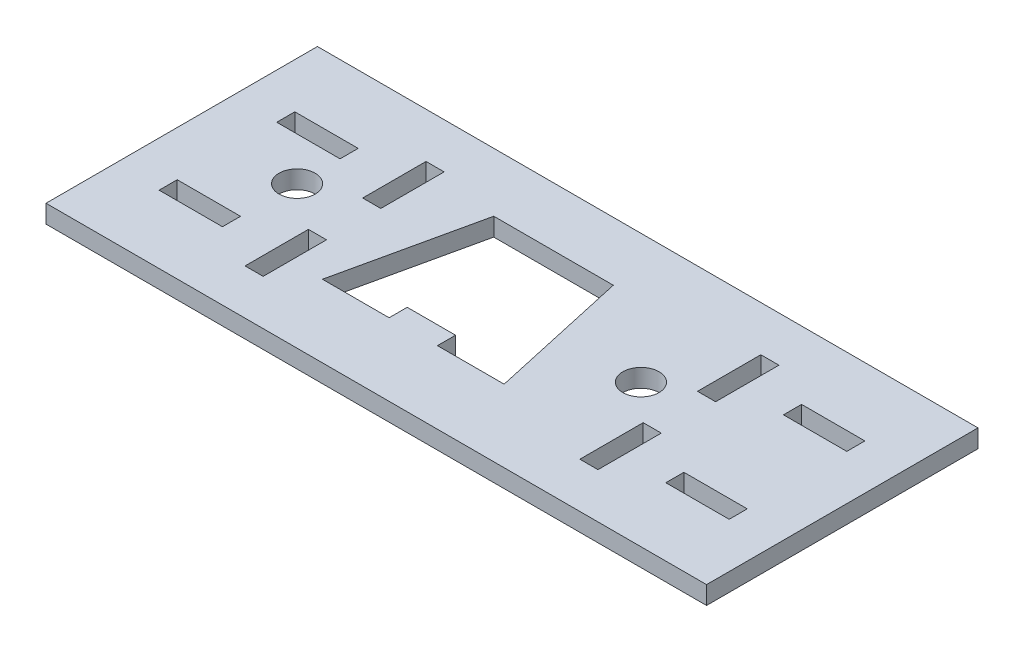
from build123d import *

# Parameters (mm, degrees)
SKETCH1_W           = 73
SKETCH1_H           = 30
SKETCH1_W_2         = 7
SKETCH1_H_2         = 2
SKETCH1_W_3         = 2
SKETCH1_H_3         = 7
BOSS_EXTRUDE1_DEPTH = 2
CUT_EXTRUDE1_DEPTH  = 10
SKETCH6_R           = 2
CUT_EXTRUDE2_DEPTH  = 19


with BuildPart() as part:
    # Sketch1 → Boss-Extrude1 (new body)
    with BuildSketch(Plane(origin=(0, 0, 0), x_dir=(1, 0, 0), z_dir=(0, 1, 0))):
        with Locations((-11.269774173, -9.91409445)):
            Rectangle(SKETCH1_W, SKETCH1_H)
        with Locations((-39.269774173, -16.41409445)):
            Rectangle(SKETCH1_W_2, SKETCH1_H_2, mode=Mode.SUBTRACT)
        with Locations((-39.269774173, -3.41409445)):
            Rectangle(SKETCH1_W_2, SKETCH1_H_2, mode=Mode.SUBTRACT)
        with Locations((16.730225827, -3.41409445)):
            Rectangle(SKETCH1_W_2, SKETCH1_H_2, mode=Mode.SUBTRACT)
        with Locations((16.730225827, -16.41409445)):
            Rectangle(SKETCH1_W_2, SKETCH1_H_2, mode=Mode.SUBTRACT)
        with Locations((-29.769774173, -3.41409445)):
            Rectangle(SKETCH1_W_3, SKETCH1_H_3, mode=Mode.SUBTRACT)
        with Locations((-29.769774173, -16.41409445)):
            Rectangle(SKETCH1_W_3, SKETCH1_H_3, mode=Mode.SUBTRACT)
        with Locations((7.230225827, -16.41409445)):
            Rectangle(SKETCH1_W_3, SKETCH1_H_3, mode=Mode.SUBTRACT)
        with Locations((7.230225827, -3.41409445)):
            Rectangle(SKETCH1_W_3, SKETCH1_H_3, mode=Mode.SUBTRACT)
    extrude(amount=BOSS_EXTRUDE1_DEPTH)

    # Sketch3 → Cut-Extrude1 (cut)
    with BuildSketch(Plane(origin=(0, 2, 0), x_dir=(1, 0, 0), z_dir=(0, 1, 0))):
        Polygon((-17.850525272, -16.91409445), (-17.850525272, -14.91409445), (-12.508752888, -14.91409445), (-12.508752888, -16.91409445), (-5.138202105, -16.91409445), (-8.574469376, -1.41409445), (-21.784808783, -1.41409445), (-25.221076054, -16.91409445), align=None)
    extrude(amount=-CUT_EXTRUDE1_DEPTH, mode=Mode.SUBTRACT)

    # Sketch6 → Cut-Extrude2 (cut)
    with BuildSketch(Plane(origin=(0, 2, 0), x_dir=(1, 0, 0), z_dir=(0, 1, 0))):
        with Locations((-35.769774173, -9.16409445)):
            Circle(SKETCH6_R)
        with Locations((2.230225827, -9.16409445)):
            Circle(SKETCH6_R)
    extrude(amount=-CUT_EXTRUDE2_DEPTH, mode=Mode.SUBTRACT)


solid = part.part
